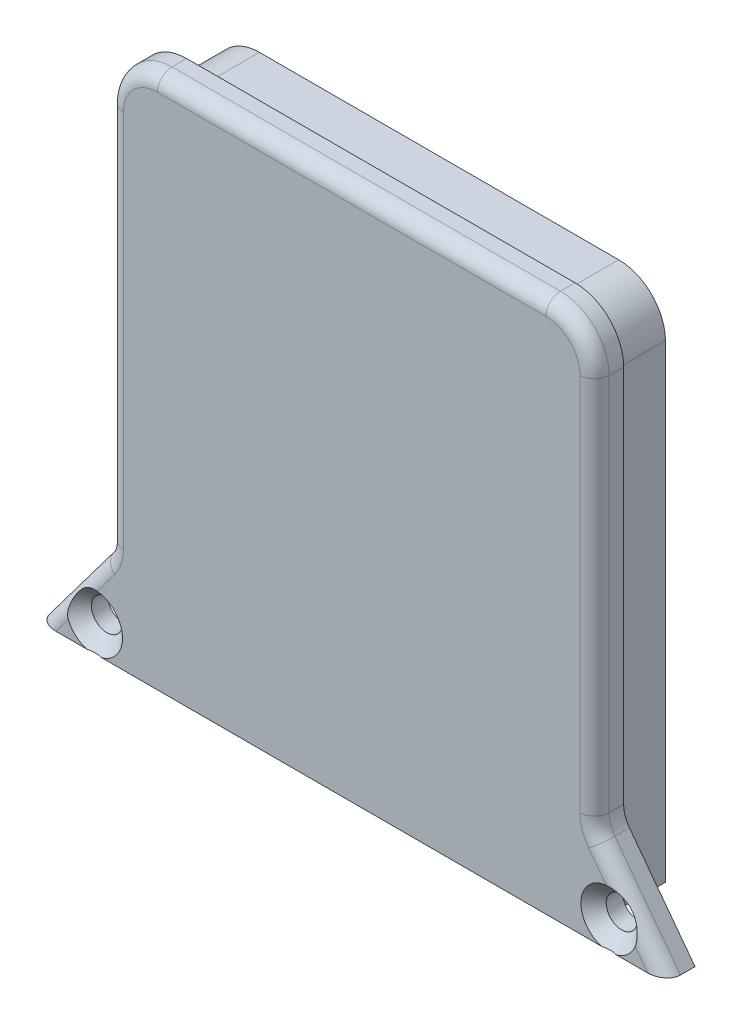
from build123d import *

# Parameters (mm, degrees)
BOSS_EXTRUDE1_DEPTH = 6
BOSS_EXTRUDE2_DEPTH = 3
SKETCH3_R           = 1.6
CUT_EXTRUDE1_DEPTH  = 67.155290794
CHAMFER1_SIZE       = 1.3
FILLET1_R           = 1.5


with BuildPart() as part:
    # Sketch1 → Boss-Extrude1 (new body)
    with BuildSketch(Plane.XY):
        with BuildLine():
            Line((-23.3, 50.5), (-23.3, 2.2))
            Line((-23.3, 2.2), (23.3, 2.2))
            Line((23.3, 2.2), (23.3, 50.5))
            ThreePointArc((23.3, 50.5), (21.89411255, 53.89411255), (18.5, 55.3))
            Line((18.5, 55.3), (-18.5, 55.3))
            ThreePointArc((-18.5, 55.3), (-21.89411255, 53.89411255), (-23.3, 50.5))
        make_face()
    extrude(amount=-BOSS_EXTRUDE1_DEPTH)

    # Sketch2 → Boss-Extrude2 (add)
    with BuildSketch(Plane.XY):
        with BuildLine():
            Line((-25.6, 11.2), (-32.35, 2.2))
            Line((-32.35, 2.2), (-23.3, 2.2))
            Line((-23.3, 2.2), (23.3, 2.2))
            Line((23.3, 2.2), (32.35, 2.2))
            Line((32.35, 2.2), (25.6, 11.2))
            ThreePointArc((25.6, 11.2), (25.153950106, 12.051316702), (25, 13))
            Line((25, 13), (25, 52))
            ThreePointArc((25, 52), (23.535533906, 55.535533906), (20, 57))
            Line((20, 57), (-20, 57))
            ThreePointArc((-20, 57), (-23.535533906, 55.535533906), (-25, 52))
            Line((-25, 52), (-25, 13))
            ThreePointArc((-25, 13), (-25.153950106, 12.051316702), (-25.6, 11.2))
        make_face()
    extrude(amount=BOSS_EXTRUDE2_DEPTH)

    # Sketch3 → Cut-Extrude1 (cut, through all)
    with BuildSketch(Plane.XY.offset(3)):
        with Locations((-26.5, 5)):
            Circle(SKETCH3_R)
        with Locations((26.5, 5)):
            Circle(SKETCH3_R)
    extrude(amount=-CUT_EXTRUDE1_DEPTH, mode=Mode.SUBTRACT)

    # Chamfer1
    # the kernel refuses this chamfer: 1.3 mm, written as the material it takes off along each edge
    with BuildSketch(Plane(origin=(-26.5, 5, 3), x_dir=(1, 0, 0), z_dir=(0, -1, 0))) as chamfer1_piece_1:
        Polygon((1.6 + CHAMFER1_SIZE, 0), (1.6, -CHAMFER1_SIZE), (1.6, 0), align=None)
    revolve(axis=Axis((-26.5, 5, 3), (0, 0, 1)), mode=Mode.SUBTRACT)
    with BuildSketch(Plane(origin=(26.5, 5, 3), x_dir=(1, 0, 0), z_dir=(0, -1, 0))) as chamfer1_piece_2:
        Polygon((1.6 + CHAMFER1_SIZE, 0), (1.6, -CHAMFER1_SIZE), (1.6, 0), align=None)
    revolve(axis=Axis((26.5, 5, 3), (0, 0, 1)), mode=Mode.SUBTRACT)

    # Fillet1
    # the kernel refuses this fillet: 1.5 mm, written as the material it takes off along each edge
    with BuildSketch(Plane(origin=(-28, 13, 3), x_dir=(1, 0, 0), z_dir=(0, 1, 0))) as fillet1_piece_1:
        with BuildLine():
            CenterArc((3 + FILLET1_R, FILLET1_R), FILLET1_R, 180, 90)
            Line((3 + FILLET1_R, 0), (3, 0))
            Line((3, 0), (3, FILLET1_R))
        make_face()
    revolve(axis=Axis((-28, 13, 3), (0, 0, -1)), revolution_arc=36.869897646, mode=Mode.SUBTRACT)
    with BuildSketch(Plane(origin=(-25.6, 11.2, 3), x_dir=(0, 0, -1), z_dir=(-0.6000000000000002, -0.7999999999999998, 0))) as fillet1_piece_2:
        with BuildLine():
            CenterArc((FILLET1_R, FILLET1_R), FILLET1_R, 180, 90)
            Line((0, FILLET1_R), (0, 0))
            Line((0, 0), (FILLET1_R, 0))
        make_face()
    extrude(amount=15, mode=Mode.SUBTRACT)
    with BuildSketch(Plane(origin=(34.6, -0.8, 3), x_dir=(-0.800000000000001, -0.5999999999999985, 0), z_dir=(-0.5999999999999985, 0.8000000000000012, 0))) as fillet1_piece_3:
        with BuildLine():
            CenterArc((FILLET1_R, -FILLET1_R), FILLET1_R, 90, 90)
            Line((0, -FILLET1_R), (0, 0))
            Line((0, 0), (FILLET1_R, 0))
        make_face()
    extrude(amount=15, mode=Mode.SUBTRACT)
    with BuildSketch(Plane(origin=(28, 13, 3), x_dir=(-0.8000000000000014, -0.5999999999999981, 0), z_dir=(0.5999999999999981, -0.8000000000000014, 0))) as fillet1_piece_4:
        with BuildLine():
            CenterArc((3 + FILLET1_R, FILLET1_R), FILLET1_R, 180, 90)
            Line((3, FILLET1_R), (3, 0))
            Line((3, 0), (3 + FILLET1_R, 0))
        make_face()
    revolve(axis=Axis((28, 13, 3), (0, 0, -1)), revolution_arc=36.869897646, mode=Mode.SUBTRACT)
    with BuildSketch(Plane(origin=(25, 13, 3), x_dir=(-1, 0, 0), z_dir=(0, 1, 0)), Plane(origin=(-25, 52, 3), x_dir=(1, 0, 0), z_dir=(0, -1, 0))) as fillet1_piece_5:
        with BuildLine():
            CenterArc((FILLET1_R, -FILLET1_R), FILLET1_R, 90, 90)
            Line((0, -FILLET1_R), (0, 0))
            Line((0, 0), (FILLET1_R, 0))
        make_face()
    extrude(amount=39, mode=Mode.SUBTRACT)
    with BuildSketch(Plane(origin=(20, 52, 3), x_dir=(1, 0, 0), z_dir=(0, -1, 0))) as fillet1_piece_6:
        with BuildLine():
            CenterArc((5 - FILLET1_R, -FILLET1_R), FILLET1_R, 0, 90)
            Line((5, -FILLET1_R), (5, 0))
            Line((5, 0), (5 - FILLET1_R, 0))
        make_face()
    revolve(axis=Axis((20, 52, 3), (0, 0, 1)), revolution_arc=90, mode=Mode.SUBTRACT)
    with BuildSketch(Plane(origin=(20, 57, 3), x_dir=(0, -1, 0), z_dir=(-1, 0, 0))) as fillet1_piece_7:
        with BuildLine():
            CenterArc((FILLET1_R, -FILLET1_R), FILLET1_R, 90, 90)
            Line((0, -FILLET1_R), (0, 0))
            Line((0, 0), (FILLET1_R, 0))
        make_face()
    extrude(amount=40, mode=Mode.SUBTRACT)
    with BuildSketch(Plane(origin=(-20, 52, 3), x_dir=(0, 1, 0), z_dir=(1, 0, 0))) as fillet1_piece_8:
        with BuildLine():
            CenterArc((5 - FILLET1_R, -FILLET1_R), FILLET1_R, 0, 90)
            Line((5, -FILLET1_R), (5, 0))
            Line((5, 0), (5 - FILLET1_R, 0))
        make_face()
    revolve(axis=Axis((-20, 52, 3), (0, 0, 1)), revolution_arc=90, mode=Mode.SUBTRACT)


solid = part.part
